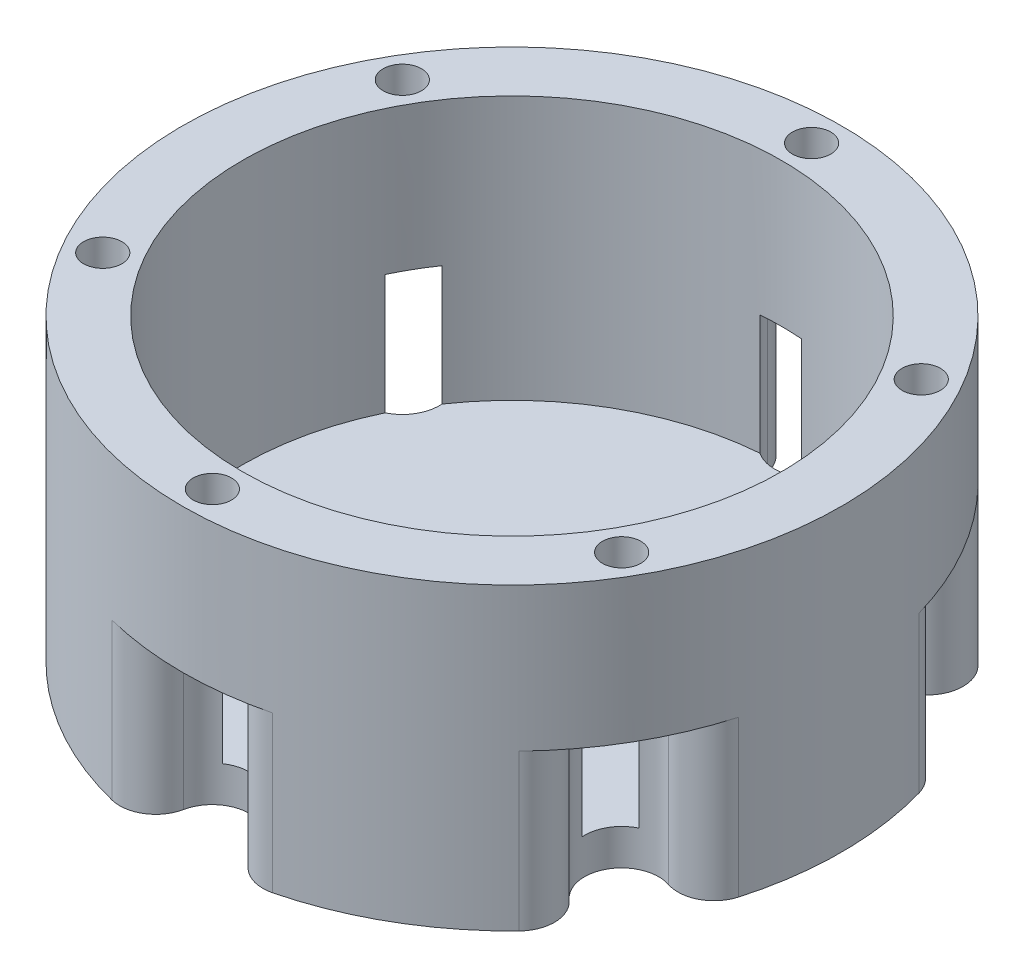
from build123d import *

# Parameters (mm, degrees)
SKETCH1_R                = 27.5
SKETCH1_R_2              = 1.6
BOSS_EXTRUDE1_DEPTH      = 25
SKETCH2_R                = 22.5
CUT_EXTRUDE1_DEPTH       = 22
SKETCH3_R                = 3.1
CUT_EXTRUDE2_DEPTH       = 13
FILLET1_R                = 3
CIRPATTERN1_COUNT        = 6
FILLET1_OF_CIRPATTERN1_R = 3


with BuildPart() as part:
    # Sketch1 → Boss-Extrude1 (new body)
    with BuildSketch(Plane(origin=(0, 0, 0), x_dir=(1, 0, 0), z_dir=(0, 1, 0))):
        Circle(SKETCH1_R)
        with Locations((0, 25)):
            Circle(SKETCH1_R_2, mode=Mode.SUBTRACT)
        with Locations((21.650635095, 12.5)):
            Circle(SKETCH1_R_2, mode=Mode.SUBTRACT)
        with Locations((21.650635095, -12.5)):
            Circle(SKETCH1_R_2, mode=Mode.SUBTRACT)
        with Locations((0, -25)):
            Circle(SKETCH1_R_2, mode=Mode.SUBTRACT)
        with Locations((-21.650635095, -12.5)):
            Circle(SKETCH1_R_2, mode=Mode.SUBTRACT)
        with Locations((-21.650635095, 12.5)):
            Circle(SKETCH1_R_2, mode=Mode.SUBTRACT)
    extrude(amount=BOSS_EXTRUDE1_DEPTH)

    # Sketch2 → Cut-Extrude1 (cut)
    with BuildSketch(Plane(origin=(0, 25, 0), x_dir=(1, 0, 0), z_dir=(0, 1, 0))):
        Circle(SKETCH2_R)
    extrude(amount=-CUT_EXTRUDE1_DEPTH, mode=Mode.SUBTRACT)

    # Sketch3 → Cut-Extrude2 (cut)
    with BuildSketch(Plane.XZ):
        with Locations((0, 25)):
            Circle(SKETCH3_R)
    cut_extrude2 = extrude(amount=-CUT_EXTRUDE2_DEPTH, mode=Mode.SUBTRACT)

    # Fillet1
    fillet1_edges = [part.edges().sort_by_distance(p)[0] for p in [
        (-1.921323544, 6.5, 27.4328),
        (1.921323544, 6.5, 27.4328),
    ]]
    fillet(fillet1_edges, radius=FILLET1_R)

    # CirPattern1: Cut-Extrude2 ×6 about axis
    cirpattern1_axis = Axis((0, 25, 0), (0, -1, 0))
    for i in range(1, CIRPATTERN1_COUNT):
        add(cut_extrude2.rotate(cirpattern1_axis, i * 360 / CIRPATTERN1_COUNT), mode=Mode.SUBTRACT)

    # Fillet1 of CirPattern1
    fillet1_of_cirpattern1_edges = [part.edges().sort_by_distance(p)[0] for p in [
        (-24.718163469, 6.5, 12.052485002),
        (-22.796839925, 6.5, 15.380314998),
        (-22.796839925, 6.5, -15.380314998),
        (-24.718163469, 6.5, -12.052485002),
        (1.921323544, 6.5, -27.4328),
        (-1.921323544, 6.5, -27.4328),
        (24.718163469, 6.5, -12.052485002),
        (22.796839925, 6.5, -15.380314998),
        (22.796839925, 6.5, 15.380314998),
        (24.718163469, 6.5, 12.052485002),
    ]]
    fillet(fillet1_of_cirpattern1_edges, radius=FILLET1_OF_CIRPATTERN1_R)


solid = part.part
